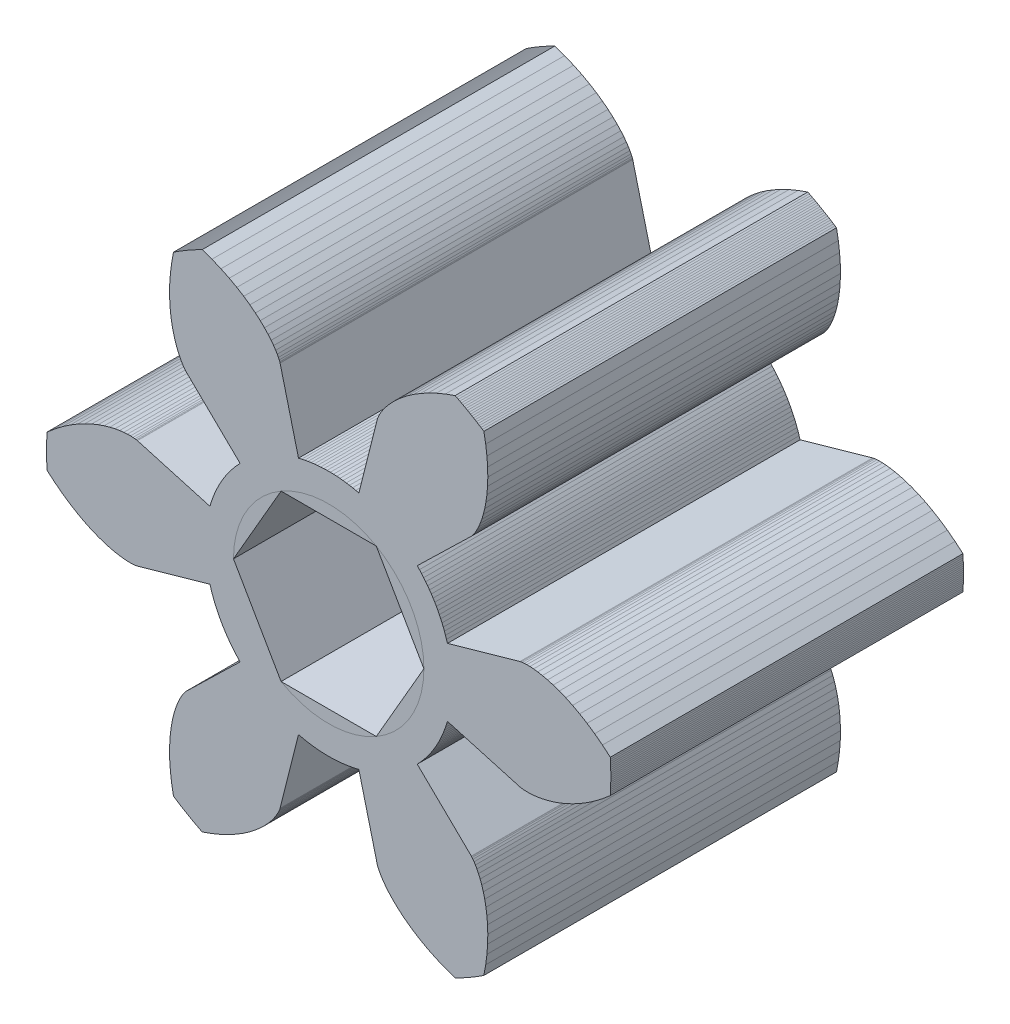
from build123d import *

# Parameters (mm, degrees)
MODEL_R               = 2.6
BOSS_EXTRUDE1_DEPTH   = 5
BOSS_EXTRUDE2_START   = -5
MODEL_3_R             = 2.6
BOSS_EXTRUDE2_DEPTH   = 5
SKETCH2_R             = 2.7
CUT_EXTRUDE3_DEPTH    = 15.667630119
BOSS_EXTRUDE6_START   = -10
BOSS_EXTRUDE6_DEPTH   = 10
BOSS_EXTRUDE7_DEPTH   = 10
BOSS_EXTRUDE7_2_DEPTH = 10
BOSS_EXTRUDE7_3_DEPTH = 10
BOSS_EXTRUDE8_DEPTH   = 10
BOSS_EXTRUDE8_2_DEPTH = 10


with BuildPart() as part:
    # Model → Boss-Extrude1 (new body)
    with BuildSketch(Plane.XY):
        Polygon((3.366864, -0.956152), (5.4236867, -1.5402669), (5.4313696, -1.5421583), (5.4546589, -1.5467409), (5.4938176, -1.5523586), (5.5489769, -1.5573371), (5.6201346, -1.5599934), (5.7071553, -1.5586454), (5.8097702, -1.5516211), (5.9275779, -1.5372682), (6.0600461, -1.5139632), (6.2065137, -1.4801209), (6.366193, -1.4342031), (6.5381735, -1.3747278), (6.7214254, -1.3002779), (6.9148042, -1.2095093), (7.1170556, -1.1011596), (7.3268211, -0.9740551), (7.5426441, -0.8271191), (7.7629759, -0.6593782), (7.9861836, -0.4699695), (7.9889386, -0.4205474), (7.9913877, -0.3711091), (7.9935309, -0.3216566), (7.9953681, -0.2721918), (7.9968992, -0.2227166), (7.9981242, -0.1732329), (7.9990429, -0.1237425), (7.9996555, -0.0742474), (7.9999617, -0.0247494), (7.9999617, 0.0247494), (7.9996555, 0.0742474), (7.9990429, 0.1237425), (7.9981242, 0.1732329), (7.9968992, 0.2227166), (7.9953681, 0.2721918), (7.9935309, 0.3216566), (7.9913877, 0.3711091), (7.9889386, 0.4205474), (7.9861836, 0.4699695), (7.7629759, 0.6593782), (7.5426441, 0.8271191), (7.3268211, 0.9740551), (7.1170556, 1.1011596), (6.9148042, 1.2095093), (6.7214254, 1.3002779), (6.5381735, 1.3747278), (6.366193, 1.4342031), (6.2065137, 1.4801209), (6.0600461, 1.5139632), (5.9275779, 1.5372682), (5.8097702, 1.5516211), (5.7071553, 1.5586454), (5.6201346, 1.5599934), (5.5489769, 1.5573371), (5.4938176, 1.5523586), (5.4546589, 1.5467409), (5.4313696, 1.5421583), (5.4236867, 1.5402669), (3.366864, 0.956152), (3.3408805, 1.0433205), (3.3126405, 1.1297844), (3.2821633, 1.2154852), (3.2494693, 1.3003652), (3.2145806, 1.3843668), (3.1775209, 1.4674335), (3.1383151, 1.5495091), (3.0969897, 1.6305381), (3.0535727, 1.710466), (3.0080933, 1.7892386), (2.9605823, 1.8668027), (2.9110718, 1.9431061), (2.8595951, 2.0180971), (2.8061871, 2.0917251), (2.7508839, 2.1639403), (2.6937227, 2.2346941), (2.6347423, 2.3039386), (2.5739823, 2.3716271), (2.511484, 2.4377138), (4.0457536, 3.9269171), (4.051233, 3.9326249), (4.0668464, 3.9505027), (4.0912908, 3.9816063), (4.1231819, 4.0268864), (4.1610612, 4.0871827), (4.2034041, 4.1632188), (4.2486284, 4.255598), (4.2951022, 4.3647989), (4.3411537, 4.4911723), (4.3850791, 4.6349381), (4.4251528, 4.7961833), (4.4596359, 4.9748604), (4.4867863, 5.1707862), (4.5048679, 5.3836414), (4.5121599, 5.6129712), (4.506967, 5.8581857), (4.4876281, 6.1185619), (4.4525262, 6.3932453), (4.4000974, 6.6812531), (4.358674, 6.7083501), (4.3170838, 6.7351902), (4.2753283, 6.7617726), (4.2334091, 6.788096), (4.1913279, 6.8141596), (4.1490862, 6.8399623), (4.1066856, 6.8655031), (4.0641279, 6.8907811), (4.0214145, 6.9157954), (3.9785472, 6.9405448), (3.9355276, 6.9650285), (3.8923573, 6.9892456), (3.849038, 7.0131952), (3.8055714, 7.0368762), (3.761959, 7.0602878), (3.7182027, 7.0834292), (3.674304, 7.1062993), (3.6302646, 7.1288975), (3.5860863, 7.1512227), (3.3104497, 7.0526235), (3.0550159, 6.9456809), (2.8198541, 6.8322408), (2.6048957, 6.7141307), (2.4099363, 6.5931507), (2.234639, 6.471064), (2.0785375, 6.3495882), (1.9410402, 6.2303864), (1.8214345, 6.115059), (1.7188924, 6.0051355), (1.6324756, 5.9020671), (1.5611418, 5.8072191), (1.5037512, 5.7218642), (1.4590734, 5.647176), (1.425795, 5.5842235), (1.4025268, 5.5339649), (1.3878125, 5.4972436), (1.3801366, 5.4747832), (1.3779331, 5.4671839), (0.8553801, 3.3938658), (0.7668981, 3.4149476), (0.6778982, 3.433723), (0.5884405, 3.4501794), (0.4985854, 3.4643055), (0.4083935, 3.4760919), (0.3179258, 3.4855305), (0.2272433, 3.4926151), (0.1364074, 3.4973408), (0.0454794, 3.4997045), (-0.0454794, 3.4997045), (-0.1364074, 3.4973408), (-0.2272433, 3.4926151), (-0.3179258, 3.4855305), (-0.4083935, 3.4760919), (-0.4985854, 3.4643055), (-0.5884405, 3.4501794), (-0.6778982, 3.433723), (-0.7668981, 3.4149476), (-0.8553801, 3.3938658), (-1.3779331, 5.4671839), (-1.3801366, 5.4747832), (-1.3878125, 5.4972436), (-1.4025268, 5.5339649), (-1.425795, 5.5842235), (-1.4590734, 5.647176), (-1.5037512, 5.7218642), (-1.5611418, 5.8072191), (-1.6324756, 5.9020671), (-1.7188924, 6.0051355), (-1.8214345, 6.115059), (-1.9410402, 6.2303864), (-2.0785375, 6.3495882), (-2.234639, 6.471064), (-2.4099363, 6.5931507), (-2.6048957, 6.7141307), (-2.8198541, 6.8322408), (-3.0550159, 6.9456809), (-3.3104497, 7.0526235), (-3.5860863, 7.1512227), (-3.6302646, 7.1288975), (-3.674304, 7.1062993), (-3.7182027, 7.0834292), (-3.761959, 7.0602878), (-3.8055714, 7.0368762), (-3.849038, 7.0131952), (-3.8923573, 6.9892456), (-3.9355276, 6.9650285), (-3.9785472, 6.9405448), (-4.0214145, 6.9157954), (-4.0641279, 6.8907811), (-4.1066856, 6.8655031), (-4.1490862, 6.8399623), (-4.1913279, 6.8141596), (-4.2334091, 6.788096), (-4.2753283, 6.7617726), (-4.3170838, 6.7351902), (-4.358674, 6.7083501), (-4.4000974, 6.6812531), (-4.4525262, 6.3932453), (-4.4876281, 6.1185619), (-4.506967, 5.8581857), (-4.5121599, 5.6129712), (-4.5048679, 5.3836414), (-4.4867863, 5.1707862), (-4.4596359, 4.9748604), (-4.4251528, 4.7961833), (-4.3850791, 4.6349381), (-4.3411537, 4.4911723), (-4.2951022, 4.3647989), (-4.2486284, 4.255598), (-4.2034041, 4.1632188), (-4.1610612, 4.0871827), (-4.1231819, 4.0268864), (-4.0912908, 3.9816063), (-4.0668464, 3.9505027), (-4.051233, 3.9326249), (-4.0457536, 3.9269171), (-2.511484, 2.4377138), (-2.5739823, 2.3716271), (-2.6347423, 2.3039386), (-2.6937227, 2.2346941), (-2.7508839, 2.1639403), (-2.8061871, 2.0917251), (-2.8595951, 2.0180971), (-2.9110718, 1.9431061), (-2.9605823, 1.8668027), (-3.0080933, 1.7892386), (-3.0535727, 1.710466), (-3.0969897, 1.6305381), (-3.1383151, 1.5495091), (-3.1775209, 1.4674335), (-3.2145806, 1.3843668), (-3.2494693, 1.3003652), (-3.2821633, 1.2154852), (-3.3126405, 1.1297844), (-3.3408805, 1.0433205), (-3.366864, 0.956152), (-5.4236867, 1.5402669), (-5.4313696, 1.5421583), (-5.4546589, 1.5467409), (-5.4938176, 1.5523586), (-5.5489769, 1.5573371), (-5.6201346, 1.5599934), (-5.7071553, 1.5586454), (-5.8097702, 1.5516211), (-5.9275779, 1.5372682), (-6.0600461, 1.5139632), (-6.2065137, 1.4801209), (-6.366193, 1.4342031), (-6.5381735, 1.3747278), (-6.7214254, 1.3002779), (-6.9148042, 1.2095093), (-7.1170556, 1.1011596), (-7.3268211, 0.9740551), (-7.5426441, 0.8271191), (-7.7629759, 0.6593782), (-7.9861836, 0.4699695), (-7.9889386, 0.4205474), (-7.9913877, 0.3711091), (-7.9935309, 0.3216566), (-7.9953681, 0.2721918), (-7.9968992, 0.2227166), (-7.9981242, 0.1732329), (-7.9990429, 0.1237425), (-7.9996555, 0.0742474), (-7.9999617, 0.0247494), (-7.9999617, -0.0247494), (-7.9996555, -0.0742474), (-7.9990429, -0.1237425), (-7.9981242, -0.1732329), (-7.9968992, -0.2227166), (-7.9953681, -0.2721918), (-7.9935309, -0.3216566), (-7.9913877, -0.3711091), (-7.9889386, -0.4205474), (-7.9861836, -0.4699695), (-7.7629759, -0.6593782), (-7.5426441, -0.8271191), (-7.3268211, -0.9740551), (-7.1170556, -1.1011596), (-6.9148042, -1.2095093), (-6.7214254, -1.3002779), (-6.5381735, -1.3747278), (-6.366193, -1.4342031), (-6.2065137, -1.4801209), (-6.0600461, -1.5139632), (-5.9275779, -1.5372682), (-5.8097702, -1.5516211), (-5.7071553, -1.5586454), (-5.6201346, -1.5599934), (-5.5489769, -1.5573371), (-5.4938176, -1.5523586), (-5.4546589, -1.5467409), (-5.4313696, -1.5421583), (-5.4236867, -1.5402669), (-3.366864, -0.956152), (-3.3408805, -1.0433205), (-3.3126405, -1.1297844), (-3.2821633, -1.2154852), (-3.2494693, -1.3003652), (-3.2145806, -1.3843668), (-3.1775209, -1.4674335), (-3.1383151, -1.5495091), (-3.0969897, -1.6305381), (-3.0535727, -1.710466), (-3.0080933, -1.7892386), (-2.9605823, -1.8668027), (-2.9110718, -1.9431061), (-2.8595951, -2.0180971), (-2.8061871, -2.0917251), (-2.7508839, -2.1639403), (-2.6937227, -2.2346941), (-2.6347423, -2.3039386), (-2.5739823, -2.3716271), (-2.511484, -2.4377138), (-4.0457536, -3.9269171), (-4.051233, -3.9326249), (-4.0668464, -3.9505027), (-4.0912908, -3.9816063), (-4.1231819, -4.0268864), (-4.1610612, -4.0871827), (-4.2034041, -4.1632188), (-4.2486284, -4.255598), (-4.2951022, -4.3647989), (-4.3411537, -4.4911723), (-4.3850791, -4.6349381), (-4.4251528, -4.7961833), (-4.4596359, -4.9748604), (-4.4867863, -5.1707862), (-4.5048679, -5.3836414), (-4.5121599, -5.6129712), (-4.506967, -5.8581857), (-4.4876281, -6.1185619), (-4.4525262, -6.3932453), (-4.4000974, -6.6812531), (-4.358674, -6.7083501), (-4.3170838, -6.7351902), (-4.2753283, -6.7617726), (-4.2334091, -6.788096), (-4.1913279, -6.8141596), (-4.1490862, -6.8399623), (-4.1066856, -6.8655031), (-4.0641279, -6.8907811), (-4.0214145, -6.9157954), (-3.9785472, -6.9405448), (-3.9355276, -6.9650285), (-3.8923573, -6.9892456), (-3.849038, -7.0131952), (-3.8055714, -7.0368762), (-3.761959, -7.0602878), (-3.7182027, -7.0834292), (-3.674304, -7.1062993), (-3.6302646, -7.1288975), (-3.5860863, -7.1512227), (-3.3104497, -7.0526235), (-3.0550159, -6.9456809), (-2.8198541, -6.8322408), (-2.6048957, -6.7141307), (-2.4099363, -6.5931507), (-2.234639, -6.471064), (-2.0785375, -6.3495882), (-1.9410402, -6.2303864), (-1.8214345, -6.115059), (-1.7188924, -6.0051355), (-1.6324756, -5.9020671), (-1.5611418, -5.8072191), (-1.5037512, -5.7218642), (-1.4590734, -5.647176), (-1.425795, -5.5842235), (-1.4025268, -5.5339649), (-1.3878125, -5.4972436), (-1.3801366, -5.4747832), (-1.3779331, -5.4671839), (-0.8553801, -3.3938658), (-0.7668981, -3.4149476), (-0.6778982, -3.433723), (-0.5884405, -3.4501794), (-0.4985854, -3.4643055), (-0.4083935, -3.4760919), (-0.3179258, -3.4855305), (-0.2272433, -3.4926151), (-0.1364074, -3.4973408), (-0.0454794, -3.4997045), (0.0454794, -3.4997045), (0.1364074, -3.4973408), (0.2272433, -3.4926151), (0.3179258, -3.4855305), (0.4083935, -3.4760919), (0.4985854, -3.4643055), (0.5884405, -3.4501794), (0.6778982, -3.433723), (0.7668981, -3.4149476), (0.8553801, -3.3938658), (1.3779331, -5.4671839), (1.3801366, -5.4747832), (1.3878125, -5.4972436), (1.4025268, -5.5339649), (1.425795, -5.5842235), (1.4590734, -5.647176), (1.5037512, -5.7218642), (1.5611418, -5.8072191), (1.6324756, -5.9020671), (1.7188924, -6.0051355), (1.8214345, -6.115059), (1.9410402, -6.2303864), (2.0785375, -6.3495882), (2.234639, -6.471064), (2.4099363, -6.5931507), (2.6048957, -6.7141307), (2.8198541, -6.8322408), (3.0550159, -6.9456809), (3.3104497, -7.0526235), (3.5860863, -7.1512227), (3.6302646, -7.1288975), (3.674304, -7.1062993), (3.7182027, -7.0834292), (3.761959, -7.0602878), (3.8055714, -7.0368762), (3.849038, -7.0131952), (3.8923573, -6.9892456), (3.9355276, -6.9650285), (3.9785472, -6.9405448), (4.0214145, -6.9157954), (4.0641279, -6.8907811), (4.1066856, -6.8655031), (4.1490862, -6.8399623), (4.1913279, -6.8141596), (4.2334091, -6.788096), (4.2753283, -6.7617726), (4.3170838, -6.7351902), (4.358674, -6.7083501), (4.4000974, -6.6812531), (4.4525262, -6.3932453), (4.4876281, -6.1185619), (4.506967, -5.8581857), (4.5121599, -5.6129712), (4.5048679, -5.3836414), (4.4867863, -5.1707862), (4.4596359, -4.9748604), (4.4251528, -4.7961833), (4.3850791, -4.6349381), (4.3411537, -4.4911723), (4.2951022, -4.3647989), (4.2486284, -4.255598), (4.2034041, -4.1632188), (4.1610612, -4.0871827), (4.1231819, -4.0268864), (4.0912908, -3.9816063), (4.0668464, -3.9505027), (4.051233, -3.9326249), (4.0457536, -3.9269171), (2.511484, -2.4377138), (2.5739823, -2.3716271), (2.6347423, -2.3039386), (2.6937227, -2.2346941), (2.7508839, -2.1639403), (2.8061871, -2.0917251), (2.8595951, -2.0180971), (2.9110718, -1.9431061), (2.9605823, -1.8668027), (3.0080933, -1.7892386), (3.0535727, -1.710466), (3.0969897, -1.6305381), (3.1383151, -1.5495091), (3.1775209, -1.4674335), (3.2145806, -1.3843668), (3.2494693, -1.3003652), (3.2821633, -1.2154852), (3.3126405, -1.1297844), (3.3408805, -1.0433205), align=None)
        Circle(MODEL_R, mode=Mode.SUBTRACT)
    extrude(amount=BOSS_EXTRUDE1_DEPTH)

    # Model<3> → Boss-Extrude2 (add)
    with BuildSketch(Plane.XY.offset(BOSS_EXTRUDE2_START)):
        Polygon((3.366864, -0.956152), (5.4236867, -1.5402669), (5.4313696, -1.5421583), (5.4546589, -1.5467409), (5.4938176, -1.5523586), (5.5489769, -1.5573371), (5.6201346, -1.5599934), (5.7071553, -1.5586454), (5.8097702, -1.5516211), (5.9275779, -1.5372682), (6.0600461, -1.5139632), (6.2065137, -1.4801209), (6.366193, -1.4342031), (6.5381735, -1.3747278), (6.7214254, -1.3002779), (6.9148042, -1.2095093), (7.1170556, -1.1011596), (7.3268211, -0.9740551), (7.5426441, -0.8271191), (7.7629759, -0.6593782), (7.9861836, -0.4699695), (7.9889386, -0.4205474), (7.9913877, -0.3711091), (7.9935309, -0.3216566), (7.9953681, -0.2721918), (7.9968992, -0.2227166), (7.9981242, -0.1732329), (7.9990429, -0.1237425), (7.9996555, -0.0742474), (7.9999617, -0.0247494), (7.9999617, 0.0247494), (7.9996555, 0.0742474), (7.9990429, 0.1237425), (7.9981242, 0.1732329), (7.9968992, 0.2227166), (7.9953681, 0.2721918), (7.9935309, 0.3216566), (7.9913877, 0.3711091), (7.9889386, 0.4205474), (7.9861836, 0.4699695), (7.7629759, 0.6593782), (7.5426441, 0.8271191), (7.3268211, 0.9740551), (7.1170556, 1.1011596), (6.9148042, 1.2095093), (6.7214254, 1.3002779), (6.5381735, 1.3747278), (6.366193, 1.4342031), (6.2065137, 1.4801209), (6.0600461, 1.5139632), (5.9275779, 1.5372682), (5.8097702, 1.5516211), (5.7071553, 1.5586454), (5.6201346, 1.5599934), (5.5489769, 1.5573371), (5.4938176, 1.5523586), (5.4546589, 1.5467409), (5.4313696, 1.5421583), (5.4236867, 1.5402669), (3.366864, 0.956152), (3.3408805, 1.0433205), (3.3126405, 1.1297844), (3.2821633, 1.2154852), (3.2494693, 1.3003652), (3.2145806, 1.3843668), (3.1775209, 1.4674335), (3.1383151, 1.5495091), (3.0969897, 1.6305381), (3.0535727, 1.710466), (3.0080933, 1.7892386), (2.9605823, 1.8668027), (2.9110718, 1.9431061), (2.8595951, 2.0180971), (2.8061871, 2.0917251), (2.7508839, 2.1639403), (2.6937227, 2.2346941), (2.6347423, 2.3039386), (2.5739823, 2.3716271), (2.511484, 2.4377138), (4.0457536, 3.9269171), (4.051233, 3.9326249), (4.0668464, 3.9505027), (4.0912908, 3.9816063), (4.1231819, 4.0268864), (4.1610612, 4.0871827), (4.2034041, 4.1632188), (4.2486284, 4.255598), (4.2951022, 4.3647989), (4.3411537, 4.4911723), (4.3850791, 4.6349381), (4.4251528, 4.7961833), (4.4596359, 4.9748604), (4.4867863, 5.1707862), (4.5048679, 5.3836414), (4.5121599, 5.6129712), (4.506967, 5.8581857), (4.4876281, 6.1185619), (4.4525262, 6.3932453), (4.4000974, 6.6812531), (4.358674, 6.7083501), (4.3170838, 6.7351902), (4.2753283, 6.7617726), (4.2334091, 6.788096), (4.1913279, 6.8141596), (4.1490862, 6.8399623), (4.1066856, 6.8655031), (4.0641279, 6.8907811), (4.0214145, 6.9157954), (3.9785472, 6.9405448), (3.9355276, 6.9650285), (3.8923573, 6.9892456), (3.849038, 7.0131952), (3.8055714, 7.0368762), (3.761959, 7.0602878), (3.7182027, 7.0834292), (3.674304, 7.1062993), (3.6302646, 7.1288975), (3.5860863, 7.1512227), (3.3104497, 7.0526235), (3.0550159, 6.9456809), (2.8198541, 6.8322408), (2.6048957, 6.7141307), (2.4099363, 6.5931507), (2.234639, 6.471064), (2.0785375, 6.3495882), (1.9410402, 6.2303864), (1.8214345, 6.115059), (1.7188924, 6.0051355), (1.6324756, 5.9020671), (1.5611418, 5.8072191), (1.5037512, 5.7218642), (1.4590734, 5.647176), (1.425795, 5.5842235), (1.4025268, 5.5339649), (1.3878125, 5.4972436), (1.3801366, 5.4747832), (1.3779331, 5.4671839), (0.8553801, 3.3938658), (0.7668981, 3.4149476), (0.6778982, 3.433723), (0.5884405, 3.4501794), (0.4985854, 3.4643055), (0.4083935, 3.4760919), (0.3179258, 3.4855305), (0.2272433, 3.4926151), (0.1364074, 3.4973408), (0.0454794, 3.4997045), (-0.0454794, 3.4997045), (-0.1364074, 3.4973408), (-0.2272433, 3.4926151), (-0.3179258, 3.4855305), (-0.4083935, 3.4760919), (-0.4985854, 3.4643055), (-0.5884405, 3.4501794), (-0.6778982, 3.433723), (-0.7668981, 3.4149476), (-0.8553801, 3.3938658), (-1.3779331, 5.4671839), (-1.3801366, 5.4747832), (-1.3878125, 5.4972436), (-1.4025268, 5.5339649), (-1.425795, 5.5842235), (-1.4590734, 5.647176), (-1.5037512, 5.7218642), (-1.5611418, 5.8072191), (-1.6324756, 5.9020671), (-1.7188924, 6.0051355), (-1.8214345, 6.115059), (-1.9410402, 6.2303864), (-2.0785375, 6.3495882), (-2.234639, 6.471064), (-2.4099363, 6.5931507), (-2.6048957, 6.7141307), (-2.8198541, 6.8322408), (-3.0550159, 6.9456809), (-3.3104497, 7.0526235), (-3.5860863, 7.1512227), (-3.6302646, 7.1288975), (-3.674304, 7.1062993), (-3.7182027, 7.0834292), (-3.761959, 7.0602878), (-3.8055714, 7.0368762), (-3.849038, 7.0131952), (-3.8923573, 6.9892456), (-3.9355276, 6.9650285), (-3.9785472, 6.9405448), (-4.0214145, 6.9157954), (-4.0641279, 6.8907811), (-4.1066856, 6.8655031), (-4.1490862, 6.8399623), (-4.1913279, 6.8141596), (-4.2334091, 6.788096), (-4.2753283, 6.7617726), (-4.3170838, 6.7351902), (-4.358674, 6.7083501), (-4.4000974, 6.6812531), (-4.4525262, 6.3932453), (-4.4876281, 6.1185619), (-4.506967, 5.8581857), (-4.5121599, 5.6129712), (-4.5048679, 5.3836414), (-4.4867863, 5.1707862), (-4.4596359, 4.9748604), (-4.4251528, 4.7961833), (-4.3850791, 4.6349381), (-4.3411537, 4.4911723), (-4.2951022, 4.3647989), (-4.2486284, 4.255598), (-4.2034041, 4.1632188), (-4.1610612, 4.0871827), (-4.1231819, 4.0268864), (-4.0912908, 3.9816063), (-4.0668464, 3.9505027), (-4.051233, 3.9326249), (-4.0457536, 3.9269171), (-2.511484, 2.4377138), (-2.5739823, 2.3716271), (-2.6347423, 2.3039386), (-2.6937227, 2.2346941), (-2.7508839, 2.1639403), (-2.8061871, 2.0917251), (-2.8595951, 2.0180971), (-2.9110718, 1.9431061), (-2.9605823, 1.8668027), (-3.0080933, 1.7892386), (-3.0535727, 1.710466), (-3.0969897, 1.6305381), (-3.1383151, 1.5495091), (-3.1775209, 1.4674335), (-3.2145806, 1.3843668), (-3.2494693, 1.3003652), (-3.2821633, 1.2154852), (-3.3126405, 1.1297844), (-3.3408805, 1.0433205), (-3.366864, 0.956152), (-5.4236867, 1.5402669), (-5.4313696, 1.5421583), (-5.4546589, 1.5467409), (-5.4938176, 1.5523586), (-5.5489769, 1.5573371), (-5.6201346, 1.5599934), (-5.7071553, 1.5586454), (-5.8097702, 1.5516211), (-5.9275779, 1.5372682), (-6.0600461, 1.5139632), (-6.2065137, 1.4801209), (-6.366193, 1.4342031), (-6.5381735, 1.3747278), (-6.7214254, 1.3002779), (-6.9148042, 1.2095093), (-7.1170556, 1.1011596), (-7.3268211, 0.9740551), (-7.5426441, 0.8271191), (-7.7629759, 0.6593782), (-7.9861836, 0.4699695), (-7.9889386, 0.4205474), (-7.9913877, 0.3711091), (-7.9935309, 0.3216566), (-7.9953681, 0.2721918), (-7.9968992, 0.2227166), (-7.9981242, 0.1732329), (-7.9990429, 0.1237425), (-7.9996555, 0.0742474), (-7.9999617, 0.0247494), (-7.9999617, -0.0247494), (-7.9996555, -0.0742474), (-7.9990429, -0.1237425), (-7.9981242, -0.1732329), (-7.9968992, -0.2227166), (-7.9953681, -0.2721918), (-7.9935309, -0.3216566), (-7.9913877, -0.3711091), (-7.9889386, -0.4205474), (-7.9861836, -0.4699695), (-7.7629759, -0.6593782), (-7.5426441, -0.8271191), (-7.3268211, -0.9740551), (-7.1170556, -1.1011596), (-6.9148042, -1.2095093), (-6.7214254, -1.3002779), (-6.5381735, -1.3747278), (-6.366193, -1.4342031), (-6.2065137, -1.4801209), (-6.0600461, -1.5139632), (-5.9275779, -1.5372682), (-5.8097702, -1.5516211), (-5.7071553, -1.5586454), (-5.6201346, -1.5599934), (-5.5489769, -1.5573371), (-5.4938176, -1.5523586), (-5.4546589, -1.5467409), (-5.4313696, -1.5421583), (-5.4236867, -1.5402669), (-3.366864, -0.956152), (-3.3408805, -1.0433205), (-3.3126405, -1.1297844), (-3.2821633, -1.2154852), (-3.2494693, -1.3003652), (-3.2145806, -1.3843668), (-3.1775209, -1.4674335), (-3.1383151, -1.5495091), (-3.0969897, -1.6305381), (-3.0535727, -1.710466), (-3.0080933, -1.7892386), (-2.9605823, -1.8668027), (-2.9110718, -1.9431061), (-2.8595951, -2.0180971), (-2.8061871, -2.0917251), (-2.7508839, -2.1639403), (-2.6937227, -2.2346941), (-2.6347423, -2.3039386), (-2.5739823, -2.3716271), (-2.511484, -2.4377138), (-4.0457536, -3.9269171), (-4.051233, -3.9326249), (-4.0668464, -3.9505027), (-4.0912908, -3.9816063), (-4.1231819, -4.0268864), (-4.1610612, -4.0871827), (-4.2034041, -4.1632188), (-4.2486284, -4.255598), (-4.2951022, -4.3647989), (-4.3411537, -4.4911723), (-4.3850791, -4.6349381), (-4.4251528, -4.7961833), (-4.4596359, -4.9748604), (-4.4867863, -5.1707862), (-4.5048679, -5.3836414), (-4.5121599, -5.6129712), (-4.506967, -5.8581857), (-4.4876281, -6.1185619), (-4.4525262, -6.3932453), (-4.4000974, -6.6812531), (-4.358674, -6.7083501), (-4.3170838, -6.7351902), (-4.2753283, -6.7617726), (-4.2334091, -6.788096), (-4.1913279, -6.8141596), (-4.1490862, -6.8399623), (-4.1066856, -6.8655031), (-4.0641279, -6.8907811), (-4.0214145, -6.9157954), (-3.9785472, -6.9405448), (-3.9355276, -6.9650285), (-3.8923573, -6.9892456), (-3.849038, -7.0131952), (-3.8055714, -7.0368762), (-3.761959, -7.0602878), (-3.7182027, -7.0834292), (-3.674304, -7.1062993), (-3.6302646, -7.1288975), (-3.5860863, -7.1512227), (-3.3104497, -7.0526235), (-3.0550159, -6.9456809), (-2.8198541, -6.8322408), (-2.6048957, -6.7141307), (-2.4099363, -6.5931507), (-2.234639, -6.471064), (-2.0785375, -6.3495882), (-1.9410402, -6.2303864), (-1.8214345, -6.115059), (-1.7188924, -6.0051355), (-1.6324756, -5.9020671), (-1.5611418, -5.8072191), (-1.5037512, -5.7218642), (-1.4590734, -5.647176), (-1.425795, -5.5842235), (-1.4025268, -5.5339649), (-1.3878125, -5.4972436), (-1.3801366, -5.4747832), (-1.3779331, -5.4671839), (-0.8553801, -3.3938658), (-0.7668981, -3.4149476), (-0.6778982, -3.433723), (-0.5884405, -3.4501794), (-0.4985854, -3.4643055), (-0.4083935, -3.4760919), (-0.3179258, -3.4855305), (-0.2272433, -3.4926151), (-0.1364074, -3.4973408), (-0.0454794, -3.4997045), (0.0454794, -3.4997045), (0.1364074, -3.4973408), (0.2272433, -3.4926151), (0.3179258, -3.4855305), (0.4083935, -3.4760919), (0.4985854, -3.4643055), (0.5884405, -3.4501794), (0.6778982, -3.433723), (0.7668981, -3.4149476), (0.8553801, -3.3938658), (1.3779331, -5.4671839), (1.3801366, -5.4747832), (1.3878125, -5.4972436), (1.4025268, -5.5339649), (1.425795, -5.5842235), (1.4590734, -5.647176), (1.5037512, -5.7218642), (1.5611418, -5.8072191), (1.6324756, -5.9020671), (1.7188924, -6.0051355), (1.8214345, -6.115059), (1.9410402, -6.2303864), (2.0785375, -6.3495882), (2.234639, -6.471064), (2.4099363, -6.5931507), (2.6048957, -6.7141307), (2.8198541, -6.8322408), (3.0550159, -6.9456809), (3.3104497, -7.0526235), (3.5860863, -7.1512227), (3.6302646, -7.1288975), (3.674304, -7.1062993), (3.7182027, -7.0834292), (3.761959, -7.0602878), (3.8055714, -7.0368762), (3.849038, -7.0131952), (3.8923573, -6.9892456), (3.9355276, -6.9650285), (3.9785472, -6.9405448), (4.0214145, -6.9157954), (4.0641279, -6.8907811), (4.1066856, -6.8655031), (4.1490862, -6.8399623), (4.1913279, -6.8141596), (4.2334091, -6.788096), (4.2753283, -6.7617726), (4.3170838, -6.7351902), (4.358674, -6.7083501), (4.4000974, -6.6812531), (4.4525262, -6.3932453), (4.4876281, -6.1185619), (4.506967, -5.8581857), (4.5121599, -5.6129712), (4.5048679, -5.3836414), (4.4867863, -5.1707862), (4.4596359, -4.9748604), (4.4251528, -4.7961833), (4.3850791, -4.6349381), (4.3411537, -4.4911723), (4.2951022, -4.3647989), (4.2486284, -4.255598), (4.2034041, -4.1632188), (4.1610612, -4.0871827), (4.1231819, -4.0268864), (4.0912908, -3.9816063), (4.0668464, -3.9505027), (4.051233, -3.9326249), (4.0457536, -3.9269171), (2.511484, -2.4377138), (2.5739823, -2.3716271), (2.6347423, -2.3039386), (2.6937227, -2.2346941), (2.7508839, -2.1639403), (2.8061871, -2.0917251), (2.8595951, -2.0180971), (2.9110718, -1.9431061), (2.9605823, -1.8668027), (3.0080933, -1.7892386), (3.0535727, -1.710466), (3.0969897, -1.6305381), (3.1383151, -1.5495091), (3.1775209, -1.4674335), (3.2145806, -1.3843668), (3.2494693, -1.3003652), (3.2821633, -1.2154852), (3.3126405, -1.1297844), (3.3408805, -1.0433205), align=None)
        Circle(MODEL_3_R, mode=Mode.SUBTRACT)
    extrude(amount=BOSS_EXTRUDE2_DEPTH)

    # Sketch2 → Cut-Extrude3 (cut, through all)
    with BuildSketch(Plane(origin=(0, 0, -5), x_dir=(-1, 0, 0), z_dir=(0, 0, -1))):
        Circle(SKETCH2_R)
    extrude(amount=-CUT_EXTRUDE3_DEPTH, mode=Mode.SUBTRACT)

    # Sketch3 → Boss-Extrude6 (add)
    with BuildSketch(Plane.XY.offset(5).offset(BOSS_EXTRUDE6_START)):
        with BuildLine():
            ThreePointArc((-2.7, 0), (-2.33826859, -1.35), (-1.35, -2.33826859))
            Line((-1.35, -2.33826859), (-2.7, 0))
        make_face()
    extrude(amount=BOSS_EXTRUDE6_DEPTH)


with BuildPart() as body_2:
    # Sketch3<4> → Boss-Extrude7 (new body)
    with BuildSketch(Plane.XY.offset(5)):
        with BuildLine():
            Line((1.35, 2.33826859), (2.7, 0))
            ThreePointArc((2.7, 0), (2.33826859, 1.35), (1.35, 2.33826859))
        make_face()
    extrude(amount=-BOSS_EXTRUDE7_DEPTH)


with BuildPart() as body_3:
    # Sketch3<4> → Boss-Extrude7 2 (new body)
    with BuildSketch(Plane.XY.offset(5)):
        with BuildLine():
            ThreePointArc((-1.35, -2.33826859), (0, -2.7), (1.35, -2.33826859))
            Line((1.35, -2.33826859), (-1.35, -2.33826859))
        make_face()
    extrude(amount=-BOSS_EXTRUDE7_2_DEPTH)


with BuildPart() as body_4:
    # Sketch3<4> → Boss-Extrude7 3 (new body)
    with BuildSketch(Plane.XY.offset(5)):
        with BuildLine():
            Line((-2.7, 0), (-1.35, 2.33826859))
            ThreePointArc((-1.35, 2.33826859), (-2.33826859, 1.35), (-2.7, 0))
        make_face()
    extrude(amount=-BOSS_EXTRUDE7_3_DEPTH)


with BuildPart() as body_5:
    # Sketch3<5> → Boss-Extrude8 (new body)
    with BuildSketch(Plane.XY.offset(5)):
        with BuildLine():
            ThreePointArc((1.35, -2.33826859), (2.33826859, -1.35), (2.7, 0))
            Line((2.7, 0), (1.35, -2.33826859))
        make_face()
    extrude(amount=-BOSS_EXTRUDE8_DEPTH)


with BuildPart() as body_6:
    # Sketch3<5> → Boss-Extrude8 2 (new body)
    with BuildSketch(Plane.XY.offset(5)):
        with BuildLine():
            Line((-1.35, 2.33826859), (1.35, 2.33826859))
            ThreePointArc((1.35, 2.33826859), (0, 2.7), (-1.35, 2.33826859))
        make_face()
    extrude(amount=-BOSS_EXTRUDE8_2_DEPTH)


solid = Compound([part.part, body_2.part, body_3.part, body_4.part, body_5.part, body_6.part])
